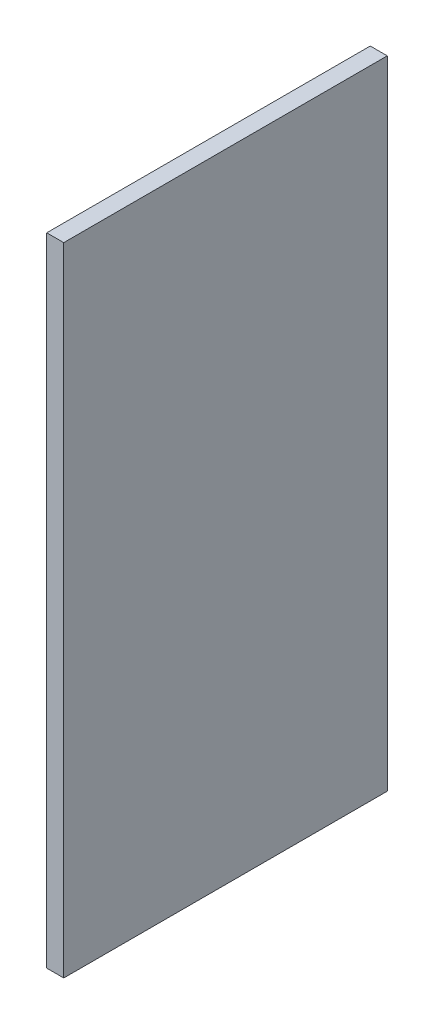
from build123d import *

# Parameters (mm, degrees)
SKETCH_1_W      = 5
SKETCH_1_H      = 95
EXTRUDE_1_DEPTH = 187


with BuildPart() as part:
    # Эскиз1 → Бобышка-Вытянуть1 (new body)
    with BuildSketch(Plane(origin=(0, 0, 0), x_dir=(1, 0, 0), z_dir=(0, 1, 0))):
        with Locations((2.5, -47.5)):
            Rectangle(SKETCH_1_W, SKETCH_1_H)
    extrude(amount=EXTRUDE_1_DEPTH)


solid = part.part
